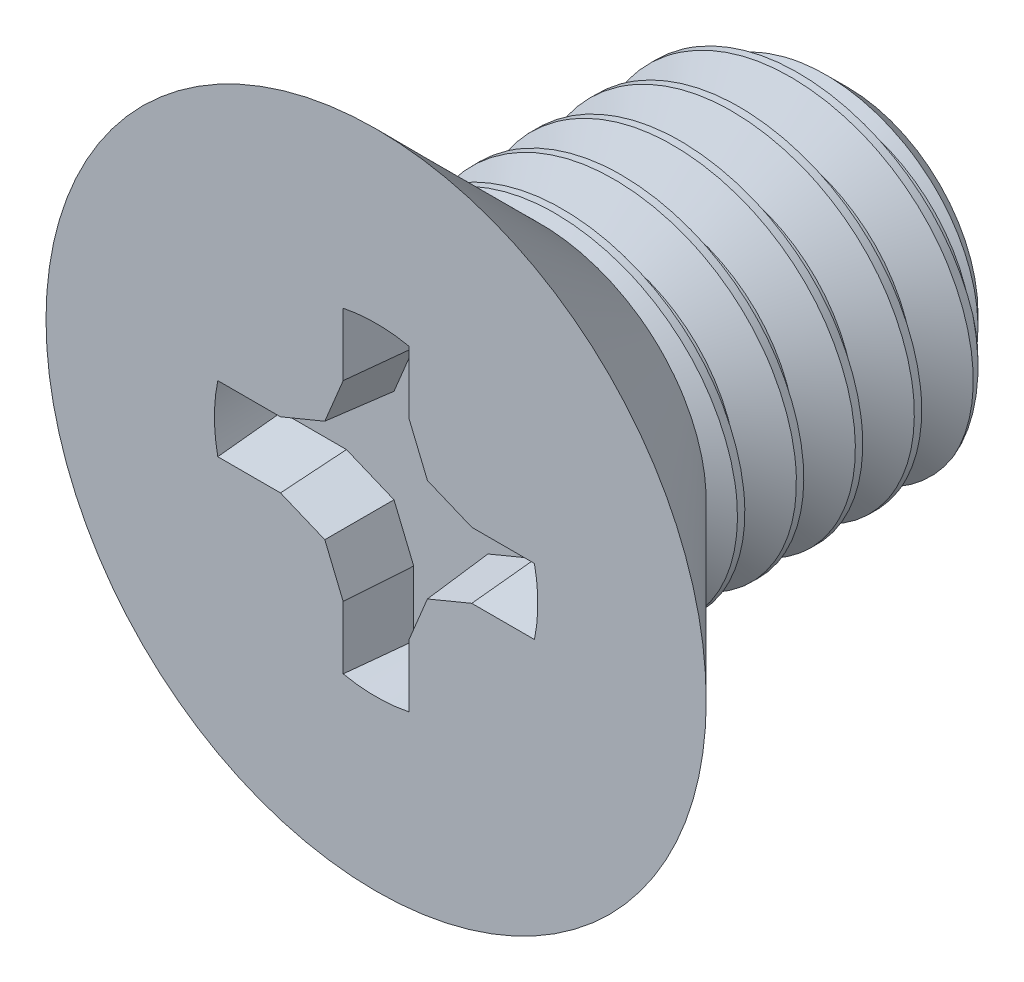
from build123d import *

# Parameters (mm, degrees)
CUT_EXTRUDE1_DEPTH  = 0.55
CIRPATTERN1_COUNT   = 4
DRAFT2_ANGLE        = 5
CUT_SWEEP1_PITCH    = 0.5
SKETCH8_R           = 1.5
BOSS_EXTRUDE1_DEPTH = 0.35
BOSS_EXTRUDE1_DRAFT = -45


with BuildPart() as part:
    # Sketch3 → Revolve1 (revolve)
    with BuildSketch(Plane(origin=(0, 0, 0), x_dir=(0, 0, -1), z_dir=(1, 0, 0)), mode=Mode.PRIVATE) as revolve1_sk:
        Polygon((-1.65, 0), (-1.65, 2.8), (-0.35, 1.5), (-0.35, 0), align=None)
    revolve(revolve1_sk.sketch.rotate(Axis((0, 0, 1.65), (0, 0, -1)), 180), axis=Axis((0, 0, 1.65), (0, 0, -1)))

    # Sketch5 → Revolve2 (revolve)
    with BuildSketch(Plane(origin=(0, 0, 0), x_dir=(0, 0, -1), z_dir=(1, 0, 0))):
        Polygon((2.35, 0), (-0.35, 0), (-0.35, 1.5), (1.955, 1.5), (2.35, 1.105), align=None)
    revolve(axis=Axis((0, 0, -2.35), (0, 0, 1)))

    # Sketch4 → Cut-Extrude1 (cut)
    with BuildSketch(Plane.XY.offset(1.65)):
        with BuildLine():
            Line((0, 0), (1.3716, 0))
            ThreePointArc((1.3716, 0), (1.36439133, 0.140438096), (1.342841093, 0.2794))
            Line((1.342841093, 0.2794), (0.811120546, 0.2794))
            Line((0.811120546, 0.2794), (0.435137342, 0.435137342))
            Line((0.435137342, 0.435137342), (0.2794, 0.811120546))
            Line((0.2794, 0.811120546), (0.2794, 1.342841093))
            ThreePointArc((0.2794, 1.342841093), (0.140438096, 1.36439133), (0, 1.3716))
            Line((0, 1.3716), (0, 0))
        make_face()
    cut_extrude1 = extrude(amount=-CUT_EXTRUDE1_DEPTH, mode=Mode.SUBTRACT)

    # CirPattern1: Cut-Extrude1 ×4 about axis
    cirpattern1_axis = Axis((0, 0, 0), (0, 0, 1))
    for i in range(1, CIRPATTERN1_COUNT):
        add(cut_extrude1.rotate(cirpattern1_axis, i * 360 / CIRPATTERN1_COUNT), mode=Mode.SUBTRACT)

    # Draft2
    draft2_faces = [part.faces().sort_by_distance(p)[0] for p in [
        (-1.076980819, 0.2794, 1.375),
        (-0.623128944, 0.357268671, 1.375),
        (-0.357268671, 0.623128944, 1.375),
        (-0.2794, 1.076980819, 1.375),
        (0.2794, 1.076980819, 1.375),
        (0.357268671, 0.623128944, 1.375),
        (0.623128944, 0.357268671, 1.375),
        (1.076980819, 0.2794, 1.375),
        (1.076980819, -0.2794, 1.375),
        (0.623128944, -0.357268671, 1.375),
        (0.357268671, -0.623128944, 1.375),
        (0.2794, -1.076980819, 1.375),
        (-0.2794, -1.076980819, 1.375),
        (-0.357268671, -0.623128944, 1.375),
        (-0.623128944, -0.357268671, 1.375),
        (-1.076980819, -0.2794, 1.375),
    ]]
    draft(draft2_faces, Plane(origin=(0, 0, 1.65), x_dir=(0, 1, 0), z_dir=(0, 0, 1)), DRAFT2_ANGLE)


with BuildPart() as body_2:
    # Split1: the piece on the far side of the plane
    add(part.part)
    split(bisect_by=Plane(origin=(0, 0, 0.35), x_dir=(0, -1, 0), z_dir=(0, 0, -1)), keep=Keep.BOTTOM)


with BuildPart() as part_1:
    add(part.part)

    # Split1
    split(bisect_by=Plane(origin=(0, 0, 0.35), x_dir=(0, -1, 0), z_dir=(0, 0, -1)), keep=Keep.TOP)

    # Cut-Sweep1: the profile of Sketch7 screwed along a right-hand helix of 8 turns, 6 arcs to a turn; built about Z, then put on its axis
    cut_sweep1_z = Axis((0, 0, 0), (0, 0, 1))
    cut_sweep1_corners = [(1.175240474, 0, -0.25), (1.175240474, 0, -0.1875), (1.527063294, 0, 0.015625), (1.527063294, 0, -0.453125)]
    with BuildLine(mode=Mode.PRIVATE) as cut_sweep1_profile:
        Line(cut_sweep1_corners[0], cut_sweep1_corners[1])
        Line(cut_sweep1_corners[1], cut_sweep1_corners[2])
        Line(cut_sweep1_corners[2], cut_sweep1_corners[3])
        Line(cut_sweep1_corners[3], cut_sweep1_corners[0])
    cut_sweep1_cap = Face(cut_sweep1_profile.wire())
    cut_sweep1_turn_angles = [0, 30, 60, 90, 120, 150, 180, 210, 240, 270, 300, 330, 360]
    cut_sweep1_turn_weights = [1, 0.8660254037844387, 1, 0.8660254037844387, 1, 0.8660254037844387, 1, 0.8660254037844387, 1, 0.8660254037844387, 1, 0.8660254037844387, 1]
    cut_sweep1_turn_rails = [Edge.make_bspline([Vector(p[0], p[1], 0).rotate(cut_sweep1_z, cut_sweep1_turn_angles[k]) / cut_sweep1_turn_weights[k] + Vector(0, 0, p[2] + CUT_SWEEP1_PITCH * cut_sweep1_turn_angles[k] / 360) for k in range(13)], [0, 0, 0, 1, 1, 2, 2, 3, 3, 4, 4, 5, 5, 6, 6, 6], 2, cut_sweep1_turn_weights) for p in cut_sweep1_corners]
    cut_sweep1_turn_sides = [Face.make_surface_from_curves(cut_sweep1_turn_rails[p[0]], cut_sweep1_turn_rails[p[1]]) for p in [(0, 1), (1, 2), (2, 3), (3, 0)]]
    cut_sweep1 = Plane(origin=(0, 0, -2.35), x_dir=(0, 1, 0), z_dir=(0, 0, 1)) * Solid(Shell([*[p.moved(Location((0, 0, CUT_SWEEP1_PITCH * i))) for i in range(8) for p in cut_sweep1_turn_sides], cut_sweep1_cap, cut_sweep1_cap.rotate(cut_sweep1_z, 2880).moved(Location((0, 0, CUT_SWEEP1_PITCH * 2880 / 360)))]))
    add(cut_sweep1, mode=Mode.SUBTRACT)


with BuildPart() as body_2_1:
    add(body_2.part)

    # Combine1: union part
    add(part_1.part)


with BuildPart() as boss_extrude1_tool:
    # Sketch8 → Boss-Extrude1 (with draft: the straight prism first)
    with BuildSketch(Plane.XY.offset(0.35)):
        Circle(SKETCH8_R)
    extrude(amount=-BOSS_EXTRUDE1_DEPTH)
    # Boss-Extrude1: the draft: its side faces are tilted about the plane it starts from
    boss_extrude1_sides = [boss_extrude1_tool.faces().sort_by_distance(p)[0] for p in [
        (-1.5, 0, 0.175),
    ]]
    draft(boss_extrude1_sides, Plane.XY.offset(0.35), BOSS_EXTRUDE1_DRAFT)


with BuildPart() as body_2_2:
    add(body_2_1.part)

    # Boss-Extrude1: add boss_extrude1_tool
    add(boss_extrude1_tool.part)


solid = body_2_2.part
